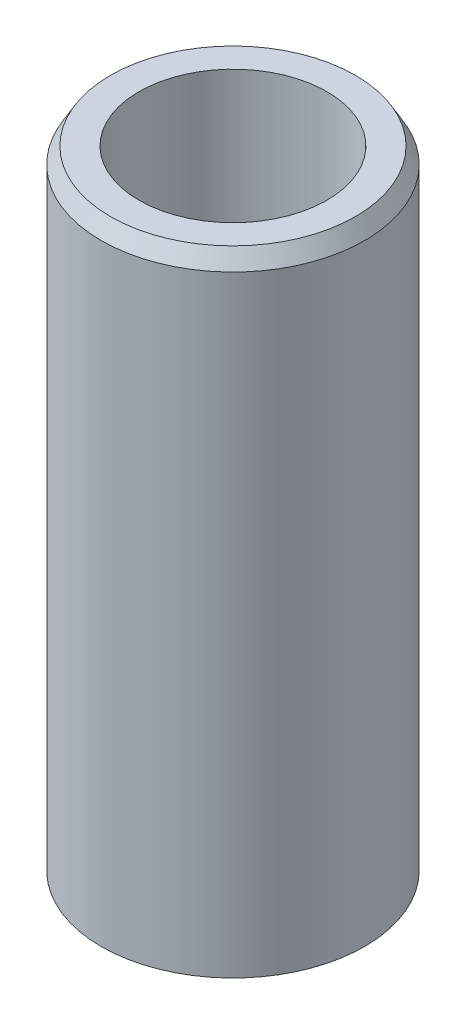
from build123d import *
from OCP.BRepFilletAPI import BRepFilletAPI_MakeChamfer

# Parameters (mm, degrees)
SKETCH1_R           = 15
BOSS_EXTRUDE1_DEPTH = 72.523152783
SKETCH2_R           = 10.709414976
CUT_EXTRUDE1_DEPTH  = 76.561946041
CHAMFER1_SIZE       = 1.834008229
CHAMFER1_SIZE2      = 1.058865144


with BuildPart() as part:
    # Sketch1 → Boss-Extrude1 (new body)
    with BuildSketch(Plane(origin=(0, 0, 0), x_dir=(1, 0, 0), z_dir=(0, 1, 0))):
        Circle(SKETCH1_R)
    extrude(amount=BOSS_EXTRUDE1_DEPTH)

    # Sketch2 → Cut-Extrude1 (cut, through all)
    with BuildSketch(Plane(origin=(0, 0, 0), x_dir=(1, 0, 0), z_dir=(0, 1, 0))):
        Circle(SKETCH2_R)
    extrude(amount=CUT_EXTRUDE1_DEPTH, mode=Mode.SUBTRACT)

    # Chamfer1: one chamfer whose edges measure the first distance from different faces: ONE call of the kernel's chamfer builder (chamfer() names one face for all edges)
    chamfer1_edges_1 = [part.edges().sort_by_distance(p)[0] for p in [
        (-15, 72.523152783, 0),
    ]]
    chamfer1_side_1 = [part.faces().sort_by_distance(p)[0] for p in [
        (-15, 36.261576391, 0),
    ]]
    chamfer1_edges_2 = [part.edges().sort_by_distance(p)[0] for p in [
        (-15, 0, 0),
    ]]
    chamfer1_side_2 = [part.faces().sort_by_distance(p)[0] for p in [
        (-14.575735931, 0, 0),
    ]]
    chamfer1 = BRepFilletAPI_MakeChamfer(part.part.solid().wrapped)
    for e in chamfer1_edges_1:
        chamfer1.Add(CHAMFER1_SIZE, CHAMFER1_SIZE2, e.wrapped, chamfer1_side_1[0].wrapped)  # the first distance lies on this face
    for e in chamfer1_edges_2:
        chamfer1.Add(CHAMFER1_SIZE, CHAMFER1_SIZE2, e.wrapped, chamfer1_side_2[0].wrapped)  # the first distance lies on this face
    add(Compound.cast(chamfer1.Shape()), mode=Mode.REPLACE)


solid = part.part
